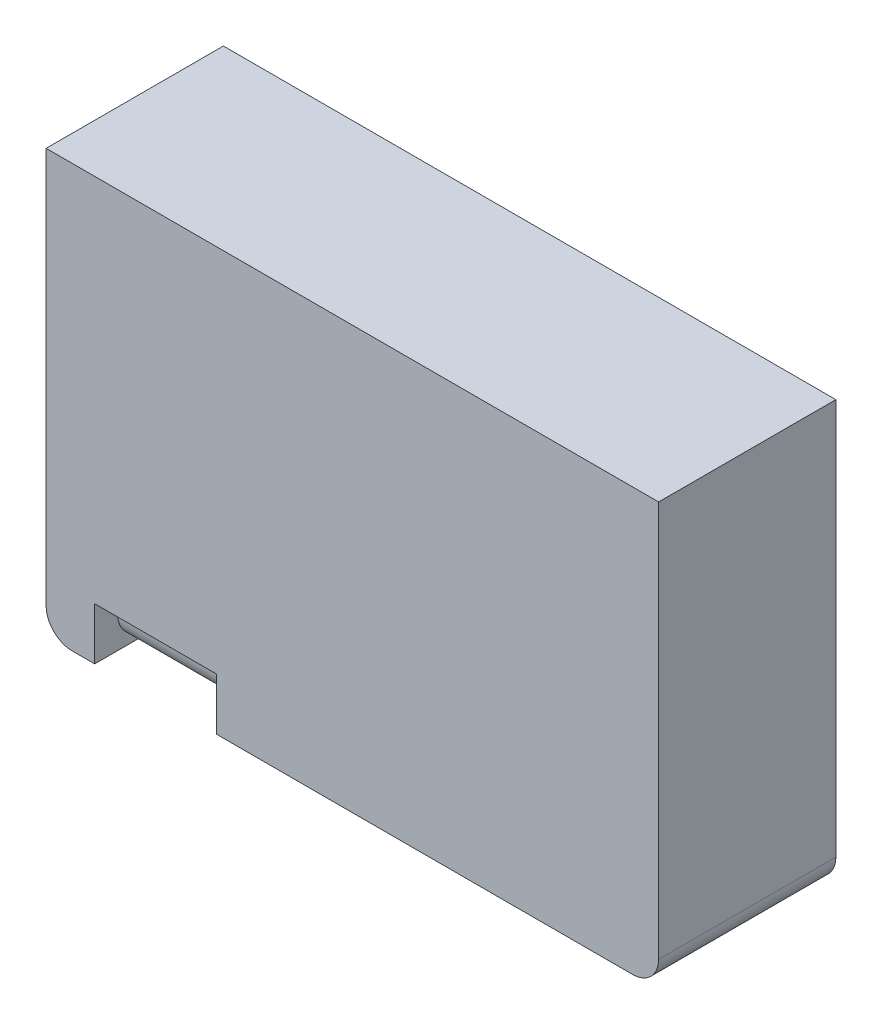
from build123d import *

# Parameters (mm, degrees)
SKETCH1_W           = 23.5
SKETCH1_H           = 16.2
BOSS_EXTRUDE1_DEPTH = 6.8
FILLET1_R           = 1
SKETCH2_R           = 2.236571794
SKETCH2_W           = 6.565566979
SKETCH2_H           = 4.473143588
SKETCH2_W_2         = 4.671371309
SKETCH2_H_2         = 6.069279627
CUT_EXTRUDE1_DEPTH  = 2
SKETCH3_W           = 4.671371309
SKETCH3_H           = 4.241891526
SKETCH3_W_2         = 6.565566979
SKETCH3_H_2         = 4.084917802
BOSS_EXTRUDE2_DEPTH = 1.8
FILLET2_R           = 1
FILLET3_R           = 2
SKETCH4_R           = 2.01406143
BOSS_EXTRUDE3_DEPTH = 1.8


with BuildPart() as part:
    # Sketch1 → Boss-Extrude1 (new body)
    with BuildSketch(Plane.XY):
        with Locations((-15.007054392, 14.50136894)):
            Rectangle(SKETCH1_W, SKETCH1_H)
    extrude(amount=BOSS_EXTRUDE1_DEPTH)

    # Fillet1
    fillet1_edges = [part.edges().sort_by_distance(p)[0] for p in [
        (-3.257054392, 6.40136894, 3.4),
        (-26.757054392, 6.40136894, 3.4),
    ]]
    fillet(fillet1_edges, radius=FILLET1_R)

    # Sketch2 → Cut-Extrude1 (cut)
    with BuildSketch(Plane.XZ.offset(-6.40136894)):
        with Locations(Location((-15.988556768, 3.515941097, 0), (0, 0, 270))):
            Circle(SKETCH2_R)
        with Locations((-7.901211447, 3.615950214)):
            Rectangle(SKETCH2_W, SKETCH2_H)
        with Locations((-22.557799993, 4.361535506)):
            Rectangle(SKETCH2_W_2, SKETCH2_H_2)
    extrude(amount=-CUT_EXTRUDE1_DEPTH, mode=Mode.SUBTRACT)

    # Sketch3 → Boss-Extrude2 (add)
    with BuildSketch(Plane(origin=(0, 8.40136894, 0), x_dir=(-1, 0, 0), z_dir=(0, -1, 0))):
        with Locations((22.557799993, -3.796232689)):
            Rectangle(SKETCH3_W, SKETCH3_H)
        with Locations((7.901211447, -3.644866315)):
            Rectangle(SKETCH3_W_2, SKETCH3_H_2)
    extrude(amount=BOSS_EXTRUDE2_DEPTH)

    # Fillet2
    fillet2_edges = [part.edges().sort_by_distance(p)[0] for p in [
        (-22.557799992, 6.60136894, 5.917178452),
        (-22.557799992, 6.60136894, 1.675286926),
    ]]
    fillet(fillet2_edges, radius=FILLET2_R)

    # Fillet3
    # the kernel refuses this fillet: 2 mm, written as the material it takes off along each edge
    with BuildSketch(Plane(origin=(-11.183994936, 6.60136894, 5.687325216), x_dir=(0, 1, 0), z_dir=(1, 0, 0))) as fillet3_piece_1:
        with BuildLine():
            CenterArc((2, -1.989974874), FILLET3_R, 95.739170477, 84.260829523)
            Line((0, -1.989974874), (0, 0))
            Line((0, 0), (1.8, 0))
        make_face()
    extrude(amount=6.565566979, mode=Mode.SUBTRACT)
    with BuildSketch(Plane(origin=(-4.618427957, 6.60136894, 1.602407414), x_dir=(0, 0, 1), z_dir=(-1, 0, 0))) as fillet3_piece_2:
        with BuildLine():
            CenterArc((1.989974874, 2), FILLET3_R, 185.739170477, 84.260829523)
            Line((0, 1.8), (0, 0))
            Line((0, 0), (1.989974874, 0))
        make_face()
    extrude(amount=6.565566979, mode=Mode.SUBTRACT)

    # Sketch4 → Boss-Extrude3 (add)
    with BuildSketch(Plane(origin=(0, 8.40136894, 0), x_dir=(-1, 0, 0), z_dir=(0, -1, 0))):
        with Locations(Location((16.007293958, -3.494565095, 0), (0, 0, 90))):
            Circle(SKETCH4_R)
    extrude(amount=BOSS_EXTRUDE3_DEPTH)


solid = part.part
